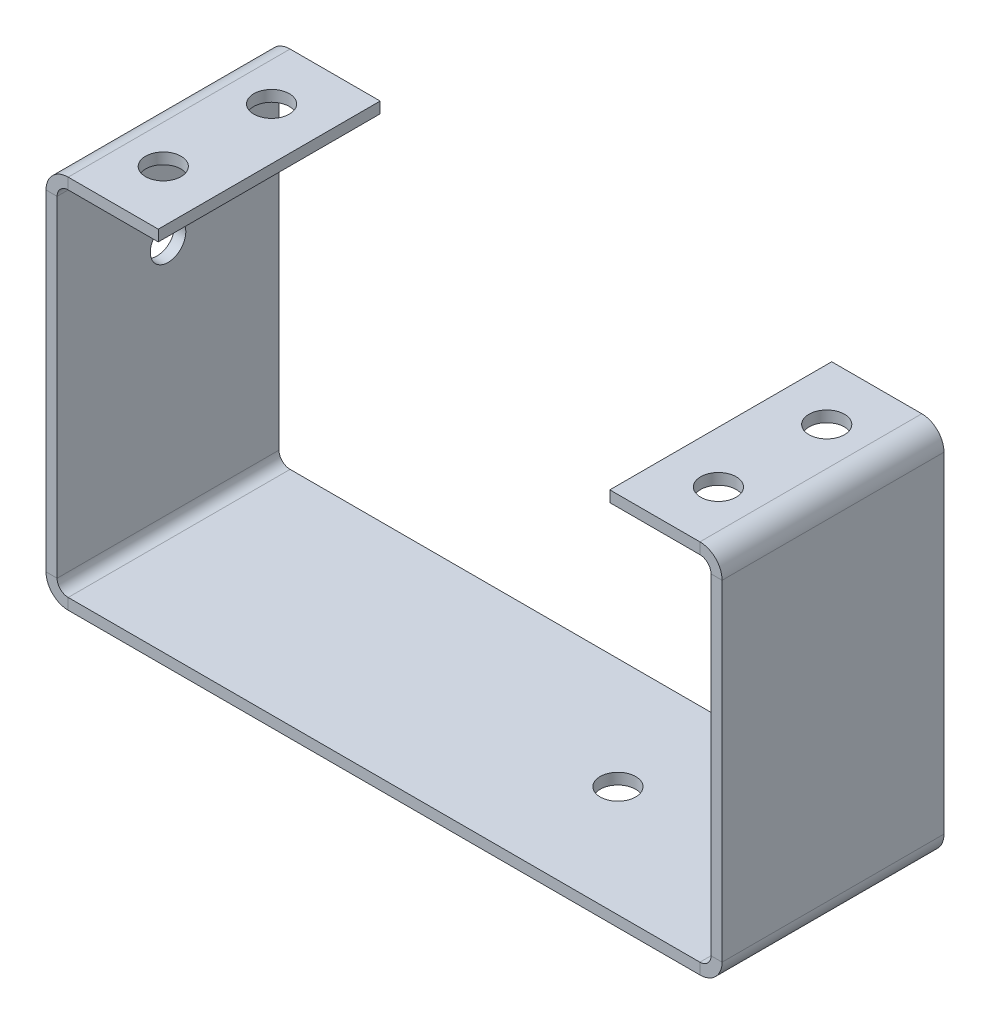
from build123d import *

# Parameters (mm, degrees)
SKETCH_2_W                = 60.94
SKETCH_2_H                = 20
EXTRUDE_1_DEPTH           = 1
SKETCH_3_W                = 1
SKETCH_3_H                = 20
EXTRUDE_2_DEPTH           = 32.81
SKETCH_4_W                = 1
SKETCH_4_H                = 20
EXTRUDE_3_DEPTH           = 32.81
SKETCH_9_W                = 20
SKETCH_9_H                = 1
EXTRUDE_8_DEPTH           = 9.12
SKETCH_10_W               = 20
SKETCH_10_H               = 1
EXTRUDE_9_DEPTH           = 9.12
SKETCH_13_R               = 1.6
CUT_EXTRUDE_2_DEPTH       = 1
SKETCH_14_R               = 1.6
CUT_EXTRUDE_3_DEPTH       = 1
SKETCH_15_R               = 1.6
CUT_EXTRUDE_4_DEPTH       = 1
SKETCH_16_R               = 1.6
CUT_EXTRUDE_5_DEPTH       = 1
SKETCH_17_R               = 1.6
CUT_EXTRUDE_6_DEPTH       = 1
CUT_EXTRUDE_7_REACH       = 74.504
SKETCH_18_R               = 1.6
SHEET_START               = 1
SHEET_METAL_1_OUTLINE_W   = 10.12
SHEET_METAL_1_OUTLINE_H   = 20
SHEET_METAL_1_OUTLINE_R   = 1.6
SHEET_METAL_1_DEPTH       = 32.81
SHEET_METAL_1_2_OUTLINE_W = 40.64238898
SHEET_METAL_1_2_OUTLINE_H = 20
SHEET_METAL_1_2_OUTLINE_R = 1.6
SHEET_METAL_1_2_DEPTH     = 1
SHEET_START_2             = -20
SHEET_METAL_1_3_DEPTH     = 20
SHEET_METAL_1_3_2_DEPTH   = 3.5199999
SHEET_START_3             = -3.5199999
SHEET_METAL_1_3_3_DEPTH   = 3.5199999
SHEET_START_4             = -13.2799999
SHEET_METAL_1_3_4_DEPTH   = 6.5599998
SHEET_METAL_1_3_5_DEPTH   = 1.6799998
SHEET_START_5             = -8.3999999
SHEET_METAL_1_3_6_DEPTH   = 1.6799998
SHEET_START_6             = -16.4800001
SHEET_METAL_1_3_7_DEPTH   = 12.9600002


with BuildPart() as part:
    # Sketch 2 → ﾎﾞｽ - 押し出し1 (new body)
    with BuildSketch(Plane(origin=(0, 0, 0), x_dir=(1, 0, 0), z_dir=(0, 1, 0))):
        with Locations((30.47, 10)):
            Rectangle(SKETCH_2_W, SKETCH_2_H)
    extrude(amount=EXTRUDE_1_DEPTH)

    # ｽｹｯﾁ3 → ﾎﾞｽ - 押し出し2 (add)
    with BuildSketch(Plane(origin=(0, 1, 0), x_dir=(1, 0, 0), z_dir=(0, 1, 0))):
        with Locations((60.44, 10)):
            Rectangle(SKETCH_3_W, SKETCH_3_H)
    extrude(amount=EXTRUDE_2_DEPTH)

    # ｽｹｯﾁ4 → ﾎﾞｽ - 押し出し3 (add)
    with BuildSketch(Plane(origin=(0, 1, 0), x_dir=(1, 0, 0), z_dir=(0, 1, 0))):
        with Locations((0.5, 10)):
            Rectangle(SKETCH_4_W, SKETCH_4_H)
    extrude(amount=EXTRUDE_3_DEPTH)

    # ｽｹｯﾁ9 → ﾎﾞｽ - 押し出し8 (add)
    with BuildSketch(Plane.ZY.offset(-59.94)):
        with Locations((-10, 33.31)):
            Rectangle(SKETCH_9_W, SKETCH_9_H)
    extrude(amount=EXTRUDE_8_DEPTH)

    # ｽｹｯﾁ10 → ﾎﾞｽ - 押し出し9 (add)
    with BuildSketch(Plane(origin=(1, 0, 0), x_dir=(0, 0, -1), z_dir=(1, 0, 0))):
        with Locations((10, 33.31)):
            Rectangle(SKETCH_10_W, SKETCH_10_H)
    extrude(amount=EXTRUDE_9_DEPTH)

    # ｽｹｯﾁ13 → ｶｯﾄ - 押し出し2 (cut)
    with BuildSketch(Plane(origin=(0, 33.81, 0), x_dir=(1, 0, 0), z_dir=(0, 1, 0))):
        with Locations(Location((55.49, 5.12, 0), (0, 0, 270))):
            Circle(SKETCH_13_R)
    extrude(amount=-CUT_EXTRUDE_2_DEPTH, mode=Mode.SUBTRACT)

    # ｽｹｯﾁ14 → ｶｯﾄ - 押し出し3 (cut)
    with BuildSketch(Plane(origin=(0, 33.81, 0), x_dir=(1, 0, 0), z_dir=(0, 1, 0))):
        with Locations(Location((55.49, 14.88, 0), (0, 0, 270))):
            Circle(SKETCH_14_R)
    extrude(amount=-CUT_EXTRUDE_3_DEPTH, mode=Mode.SUBTRACT)

    # ｽｹｯﾁ15 → ｶｯﾄ - 押し出し4 (cut)
    with BuildSketch(Plane(origin=(0, 33.81, 0), x_dir=(1, 0, 0), z_dir=(0, 1, 0))):
        with Locations(Location((5.45, 5.12, 0), (0, 0, 270))):
            Circle(SKETCH_15_R)
    extrude(amount=-CUT_EXTRUDE_4_DEPTH, mode=Mode.SUBTRACT)

    # ｽｹｯﾁ16 → ｶｯﾄ - 押し出し5 (cut)
    with BuildSketch(Plane(origin=(0, 33.81, 0), x_dir=(1, 0, 0), z_dir=(0, 1, 0))):
        with Locations(Location((5.45, 14.88, 0), (0, 0, 270))):
            Circle(SKETCH_16_R)
    extrude(amount=-CUT_EXTRUDE_5_DEPTH, mode=Mode.SUBTRACT)

    # ｽｹｯﾁ17 → ｶｯﾄ - 押し出し6 (cut)
    with BuildSketch(Plane(origin=(0, 0, 0), x_dir=(-1, 0, 0), z_dir=(0, -1, 0))):
        with Locations(Location((-41.55, 10, 0), (0, 0, 90))):
            Circle(SKETCH_17_R)
    extrude(amount=-CUT_EXTRUDE_6_DEPTH, mode=Mode.SUBTRACT)

    # ｽｹｯﾁ18 → ｶｯﾄ - 押し出し7 (cut, up to next)
    with BuildSketch(Plane.ZY, mode=Mode.PRIVATE) as cut_extrude_7_sk1:
        with Locations((-10, 23.25)):
            Circle(SKETCH_18_R)
    cut_extrude_7_tool1 = extrude(cut_extrude_7_sk1.sketch, amount=-CUT_EXTRUDE_7_REACH, mode=Mode.PRIVATE) & part.part
    add(cut_extrude_7_tool1.solids().sort_by_distance((0, 23.25, -10))[0], mode=Mode.SUBTRACT)

    # Sheet Metal 1: read off the stored shape, not the designer's step
    # Sheet Metal 1 outline → Sheet Metal 1 (cut)
    # profile 1 of 2: a face of its own
    with BuildSketch(Plane(origin=(0, 0, 0), x_dir=(1, 0, 0), z_dir=(0, 1, 0)).offset(SHEET_START)):
        with Locations((55.88, 10)):
            Rectangle(SHEET_METAL_1_OUTLINE_W, SHEET_METAL_1_OUTLINE_H)
        with Locations((55.49, 14.88)):
            Circle(SHEET_METAL_1_OUTLINE_R, mode=Mode.SUBTRACT)
        with Locations((55.49, 5.12)):
            Circle(SHEET_METAL_1_OUTLINE_R, mode=Mode.SUBTRACT)
    # profile 2 of 2: a face of its own
    with BuildSketch(Plane(origin=(0, 0, 0), x_dir=(1, 0, 0), z_dir=(0, 1, 0)).offset(SHEET_START)):
        with Locations((5.06, 10)):
            Rectangle(SHEET_METAL_1_OUTLINE_W, SHEET_METAL_1_OUTLINE_H)
        with Locations((5.45, 5.12)):
            Circle(SHEET_METAL_1_OUTLINE_R, mode=Mode.SUBTRACT)
        with Locations((5.45, 14.88)):
            Circle(SHEET_METAL_1_OUTLINE_R, mode=Mode.SUBTRACT)
    extrude(amount=SHEET_METAL_1_DEPTH, mode=Mode.SUBTRACT)

    # Sheet Metal 1 2 outline → Sheet Metal 1 2 (add)
    # profile 1 of 2: a face of its own
    with BuildSketch(Plane(origin=(0, 0, 0), x_dir=(1, 0, 0), z_dir=(0, 1, 0))):
        with Locations((81.26119449, 10)):
            Rectangle(SHEET_METAL_1_2_OUTLINE_W, SHEET_METAL_1_2_OUTLINE_H)
        with Locations((96.91238898, 5.12)):
            Circle(SHEET_METAL_1_2_OUTLINE_R, mode=Mode.SUBTRACT)
        with Locations((96.91238898, 14.88)):
            Circle(SHEET_METAL_1_2_OUTLINE_R, mode=Mode.SUBTRACT)
    # profile 2 of 2: a face of its own
    with BuildSketch(Plane(origin=(0, 0, 0), x_dir=(1, 0, 0), z_dir=(0, 1, 0))):
        with Locations((-20.32119449, 10)):
            Rectangle(SHEET_METAL_1_2_OUTLINE_W, SHEET_METAL_1_2_OUTLINE_H)
        with Locations((-35.97238898, 5.12)):
            Circle(SHEET_METAL_1_2_OUTLINE_R, mode=Mode.SUBTRACT)
        with Locations((-21.60619449, 10)):
            Circle(SHEET_METAL_1_2_OUTLINE_R, mode=Mode.SUBTRACT)
        with Locations((-35.97238898, 14.88)):
            Circle(SHEET_METAL_1_2_OUTLINE_R, mode=Mode.SUBTRACT)
    extrude(amount=SHEET_METAL_1_2_DEPTH)

    # Sheet Metal 1 3: read off the stored shape, not the designer's step
    # Sheet Metal 1 3 outline → Sheet Metal 1 3 (cut)
    with BuildSketch(Plane.XY.offset(SHEET_START_2)):
        with BuildLine():
            ThreePointArc((2, 0), (1, 0.267949193), (0.267949193, 1))
            Line((0.267949193, 1), (-40.64238898, 1))
            Line((-40.64238898, 1), (-40.64238898, 0))
            Line((-40.64238898, 0), (2, 0))
        make_face()
        with BuildLine():
            Line((101.58238898, 1), (60.672050807, 1))
            ThreePointArc((60.672050807, 1), (59.94, 0.267949193), (58.94, 0))
            Line((58.94, 0), (101.58238898, 0))
            Line((101.58238898, 0), (101.58238898, 1))
        make_face()
    extrude(amount=SHEET_METAL_1_3_DEPTH, mode=Mode.SUBTRACT)

    # Sheet Metal 1 3 2 outline → Sheet Metal 1 3 2 (add)
    with BuildSketch(Plane.XY.offset(SHEET_START_2)):
        with BuildLine():
            Line((2, 32.81), (10.12, 32.81))
            Line((10.12, 32.81), (10.12, 33.81))
            Line((10.12, 33.81), (2, 33.81))
            ThreePointArc((2, 33.81), (0.585786438, 33.224213562), (0, 31.81))
            Line((0, 31.81), (0, 2))
            ThreePointArc((0, 2), (0.068148348, 1.48236191), (0.267949193, 1))
            Line((0.267949193, 1), (2, 1))
            ThreePointArc((2, 1), (1.292893219, 1.292893219), (1, 2))
            Line((1, 2), (1, 31.81))
            ThreePointArc((1, 31.81), (1.292893219, 32.517106781), (2, 32.81))
        make_face()
        with BuildLine():
            Line((58.94, 33.81), (50.82, 33.81))
            Line((50.82, 33.81), (50.82, 32.81))
            Line((50.82, 32.81), (58.94, 32.81))
            ThreePointArc((58.94, 32.81), (59.647106781, 32.517106781), (59.94, 31.81))
            Line((59.94, 31.81), (59.94, 2))
            ThreePointArc((59.94, 2), (59.647106781, 1.292893219), (58.94, 1))
            Line((58.94, 1), (60.672050807, 1))
            ThreePointArc((60.672050807, 1), (60.871851652, 1.48236191), (60.94, 2))
            Line((60.94, 2), (60.94, 31.81))
            ThreePointArc((60.94, 31.81), (60.354213562, 33.224213562), (58.94, 33.81))
        make_face()
    extrude(amount=SHEET_METAL_1_3_2_DEPTH)

    # Sheet Metal 1 3 3 outline → Sheet Metal 1 3 3 (add)
    with BuildSketch(Plane.XY.offset(SHEET_START_3)):
        with BuildLine():
            Line((2, 32.81), (10.12, 32.81))
            Line((10.12, 32.81), (10.12, 33.81))
            Line((10.12, 33.81), (2, 33.81))
            ThreePointArc((2, 33.81), (0.585786438, 33.224213562), (0, 31.81))
            Line((0, 31.81), (0, 2))
            ThreePointArc((0, 2), (0.068148348, 1.48236191), (0.267949193, 1))
            Line((0.267949193, 1), (2, 1))
            ThreePointArc((2, 1), (1.292893219, 1.292893219), (1, 2))
            Line((1, 2), (1, 31.81))
            ThreePointArc((1, 31.81), (1.292893219, 32.517106781), (2, 32.81))
        make_face()
        with BuildLine():
            Line((58.94, 33.81), (50.82, 33.81))
            Line((50.82, 33.81), (50.82, 32.81))
            Line((50.82, 32.81), (58.94, 32.81))
            ThreePointArc((58.94, 32.81), (59.647106781, 32.517106781), (59.94, 31.81))
            Line((59.94, 31.81), (59.94, 2))
            ThreePointArc((59.94, 2), (59.647106781, 1.292893219), (58.94, 1))
            Line((58.94, 1), (60.672050807, 1))
            ThreePointArc((60.672050807, 1), (60.871851652, 1.48236191), (60.94, 2))
            Line((60.94, 2), (60.94, 31.81))
            ThreePointArc((60.94, 31.81), (60.354213562, 33.224213562), (58.94, 33.81))
        make_face()
    extrude(amount=SHEET_METAL_1_3_3_DEPTH)

    # Sheet Metal 1 3 4 outline → Sheet Metal 1 3 4 (add)
    with BuildSketch(Plane.XY.offset(SHEET_START_4)):
        with BuildLine():
            Line((58.94, 33.81), (50.82, 33.81))
            Line((50.82, 33.81), (50.82, 32.81))
            Line((50.82, 32.81), (58.94, 32.81))
            ThreePointArc((58.94, 32.81), (59.647106781, 32.517106781), (59.94, 31.81))
            Line((59.94, 31.81), (59.94, 2))
            ThreePointArc((59.94, 2), (59.647106781, 1.292893219), (58.94, 1))
            Line((58.94, 1), (60.672050807, 1))
            ThreePointArc((60.672050807, 1), (60.871851652, 1.48236191), (60.94, 2))
            Line((60.94, 2), (60.94, 31.81))
            ThreePointArc((60.94, 31.81), (60.354213562, 33.224213562), (58.94, 33.81))
        make_face()
    extrude(amount=SHEET_METAL_1_3_4_DEPTH)

    # Sheet Metal 1 3 5 outline → Sheet Metal 1 3 5 (add)
    with BuildSketch(Plane.XY.offset(SHEET_START_4)):
        with BuildLine():
            Line((2, 32.81), (10.12, 32.81))
            Line((10.12, 32.81), (10.12, 33.81))
            Line((10.12, 33.81), (2, 33.81))
            ThreePointArc((2, 33.81), (0.585786438, 33.224213562), (0, 31.81))
            Line((0, 31.81), (0, 2))
            ThreePointArc((0, 2), (0.068148348, 1.48236191), (0.267949193, 1))
            Line((0.267949193, 1), (2, 1))
            ThreePointArc((2, 1), (1.292893219, 1.292893219), (1, 2))
            Line((1, 2), (1, 31.81))
            ThreePointArc((1, 31.81), (1.292893219, 32.517106781), (2, 32.81))
        make_face()
    extrude(amount=SHEET_METAL_1_3_5_DEPTH)

    # Sheet Metal 1 3 6 outline → Sheet Metal 1 3 6 (add)
    with BuildSketch(Plane.XY.offset(SHEET_START_5)):
        with BuildLine():
            Line((2, 32.81), (10.12, 32.81))
            Line((10.12, 32.81), (10.12, 33.81))
            Line((10.12, 33.81), (2, 33.81))
            ThreePointArc((2, 33.81), (0.585786438, 33.224213562), (0, 31.81))
            Line((0, 31.81), (0, 2))
            ThreePointArc((0, 2), (0.068148348, 1.48236191), (0.267949193, 1))
            Line((0.267949193, 1), (2, 1))
            ThreePointArc((2, 1), (1.292893219, 1.292893219), (1, 2))
            Line((1, 2), (1, 31.81))
            ThreePointArc((1, 31.81), (1.292893219, 32.517106781), (2, 32.81))
        make_face()
    extrude(amount=SHEET_METAL_1_3_6_DEPTH)

    # Sheet Metal 1 3 7 outline → Sheet Metal 1 3 7 (add)
    with BuildSketch(Plane.XY.offset(SHEET_START_6)):
        with BuildLine():
            Line((2, 32.81), (10.12, 32.81))
            Line((10.12, 32.81), (10.12, 33.81))
            Line((10.12, 33.81), (2, 33.81))
            ThreePointArc((2, 33.81), (0.585786438, 33.224213562), (0, 31.81))
            Line((0, 31.81), (0, 2))
            ThreePointArc((0, 2), (0.068148348, 1.48236191), (0.267949193, 1))
            Line((0.267949193, 1), (2, 1))
            ThreePointArc((2, 1), (1.292893219, 1.292893219), (1, 2))
            Line((1, 2), (1, 31.81))
            ThreePointArc((1, 31.81), (1.292893219, 32.517106781), (2, 32.81))
        make_face()
        with BuildLine():
            ThreePointArc((59.94, 2), (59.647106781, 1.292893219), (58.94, 1))
            Line((58.94, 1), (60.672050807, 1))
            ThreePointArc((60.672050807, 1), (60.871851652, 1.48236191), (60.94, 2))
            Line((60.94, 2), (60.94, 31.81))
            ThreePointArc((60.94, 31.81), (60.354213562, 33.224213562), (58.94, 33.81))
            Line((58.94, 33.81), (50.82, 33.81))
            Line((50.82, 33.81), (50.82, 32.81))
            Line((50.82, 32.81), (58.94, 32.81))
            ThreePointArc((58.94, 32.81), (59.647106781, 32.517106781), (59.94, 31.81))
            Line((59.94, 31.81), (59.94, 2))
        make_face()
    extrude(amount=SHEET_METAL_1_3_7_DEPTH)

    # Sheet Metal 1 3 8: loft between two sections, ruled curve by curve
    sheet_metal_1_3_8_from = [
        Edge.make_three_point_arc((5.45, 32.81, -3.52), (7.05, 32.81, -5.12), (5.45, 32.81, -6.72)),
        Edge.make_three_point_arc((5.45, 32.81, -6.72), (3.85, 32.81, -5.12), (5.45, 32.81, -3.52)),
    ]
    sheet_metal_1_3_8_to = [
        Edge.make_three_point_arc((5.45, 33.81, -3.52), (7.05, 33.81, -5.12), (5.45, 33.81, -6.72)),
        Edge.make_three_point_arc((5.45, 33.81, -6.72), (3.85, 33.81, -5.12), (5.45, 33.81, -3.52)),
    ]
    sheet_metal_1_3_8 = Solid(Shell([*[Face.make_surface_from_curves(sheet_metal_1_3_8_from[k], sheet_metal_1_3_8_to[k]) for k in range(2)], Face(Wire(sheet_metal_1_3_8_from)), Face(Wire(sheet_metal_1_3_8_to))]))
    add(sheet_metal_1_3_8, mode=Mode.SUBTRACT)

    # Sheet Metal 1 3 9: loft between two sections, ruled curve by curve
    sheet_metal_1_3_9_from = [
        Edge.make_three_point_arc((5.45, 32.81, -13.28), (7.05, 32.81, -14.88), (5.45, 32.81, -16.48)),
        Edge.make_three_point_arc((5.45, 32.81, -16.48), (3.85, 32.81, -14.88), (5.45, 32.81, -13.28)),
    ]
    sheet_metal_1_3_9_to = [
        Edge.make_three_point_arc((5.45, 33.81, -13.28), (7.05, 33.81, -14.88), (5.45, 33.81, -16.48)),
        Edge.make_three_point_arc((5.45, 33.81, -16.48), (3.85, 33.81, -14.88), (5.45, 33.81, -13.28)),
    ]
    sheet_metal_1_3_9 = Solid(Shell([*[Face.make_surface_from_curves(sheet_metal_1_3_9_from[k], sheet_metal_1_3_9_to[k]) for k in range(2)], Face(Wire(sheet_metal_1_3_9_from)), Face(Wire(sheet_metal_1_3_9_to))]))
    add(sheet_metal_1_3_9, mode=Mode.SUBTRACT)

    # Sheet Metal 1 3 10: loft between two sections, ruled curve by curve
    sheet_metal_1_3_10_from = [
        Edge.make_three_point_arc((55.49, 32.81, -3.52), (57.09, 32.81, -5.12), (55.49, 32.81, -6.72)),
        Edge.make_three_point_arc((55.49, 32.81, -6.72), (53.89, 32.81, -5.12), (55.49, 32.81, -3.52)),
    ]
    sheet_metal_1_3_10_to = [
        Edge.make_three_point_arc((55.49, 33.81, -3.52), (57.09, 33.81, -5.12), (55.49, 33.81, -6.72)),
        Edge.make_three_point_arc((55.49, 33.81, -6.72), (53.89, 33.81, -5.12), (55.49, 33.81, -3.52)),
    ]
    sheet_metal_1_3_10 = Solid(Shell([*[Face.make_surface_from_curves(sheet_metal_1_3_10_from[k], sheet_metal_1_3_10_to[k]) for k in range(2)], Face(Wire(sheet_metal_1_3_10_from)), Face(Wire(sheet_metal_1_3_10_to))]))
    add(sheet_metal_1_3_10, mode=Mode.SUBTRACT)

    # Sheet Metal 1 3 11: loft between two sections, ruled curve by curve
    sheet_metal_1_3_11_from = [
        Edge.make_three_point_arc((55.49, 32.81, -13.28), (57.09, 32.81, -14.88), (55.49, 32.81, -16.48)),
        Edge.make_three_point_arc((55.49, 32.81, -16.48), (53.89, 32.81, -14.88), (55.49, 32.81, -13.28)),
    ]
    sheet_metal_1_3_11_to = [
        Edge.make_three_point_arc((55.49, 33.81, -13.28), (57.09, 33.81, -14.88), (55.49, 33.81, -16.48)),
        Edge.make_three_point_arc((55.49, 33.81, -16.48), (53.89, 33.81, -14.88), (55.49, 33.81, -13.28)),
    ]
    sheet_metal_1_3_11 = Solid(Shell([*[Face.make_surface_from_curves(sheet_metal_1_3_11_from[k], sheet_metal_1_3_11_to[k]) for k in range(2)], Face(Wire(sheet_metal_1_3_11_from)), Face(Wire(sheet_metal_1_3_11_to))]))
    add(sheet_metal_1_3_11, mode=Mode.SUBTRACT)

    # Sheet Metal 1 3 12: loft between two sections, ruled curve by curve
    sheet_metal_1_3_12_from = [
        Edge.make_three_point_arc((1, 23.25, -8.4), (1, 24.85, -10), (1, 23.25, -11.6)),
        Edge.make_three_point_arc((1, 23.25, -11.6), (1, 21.65, -10), (1, 23.25, -8.4)),
    ]
    sheet_metal_1_3_12_to = [
        Edge.make_three_point_arc((0, 23.25, -8.4), (0, 24.85, -10), (0, 23.25, -11.6)),
        Edge.make_three_point_arc((0, 23.25, -11.6), (0, 21.65, -10), (0, 23.25, -8.4)),
    ]
    sheet_metal_1_3_12 = Solid(Shell([*[Face.make_surface_from_curves(sheet_metal_1_3_12_from[k], sheet_metal_1_3_12_to[k]) for k in range(2)], Face(Wire(sheet_metal_1_3_12_from)), Face(Wire(sheet_metal_1_3_12_to))]))
    add(sheet_metal_1_3_12, mode=Mode.SUBTRACT)


solid = part.part
